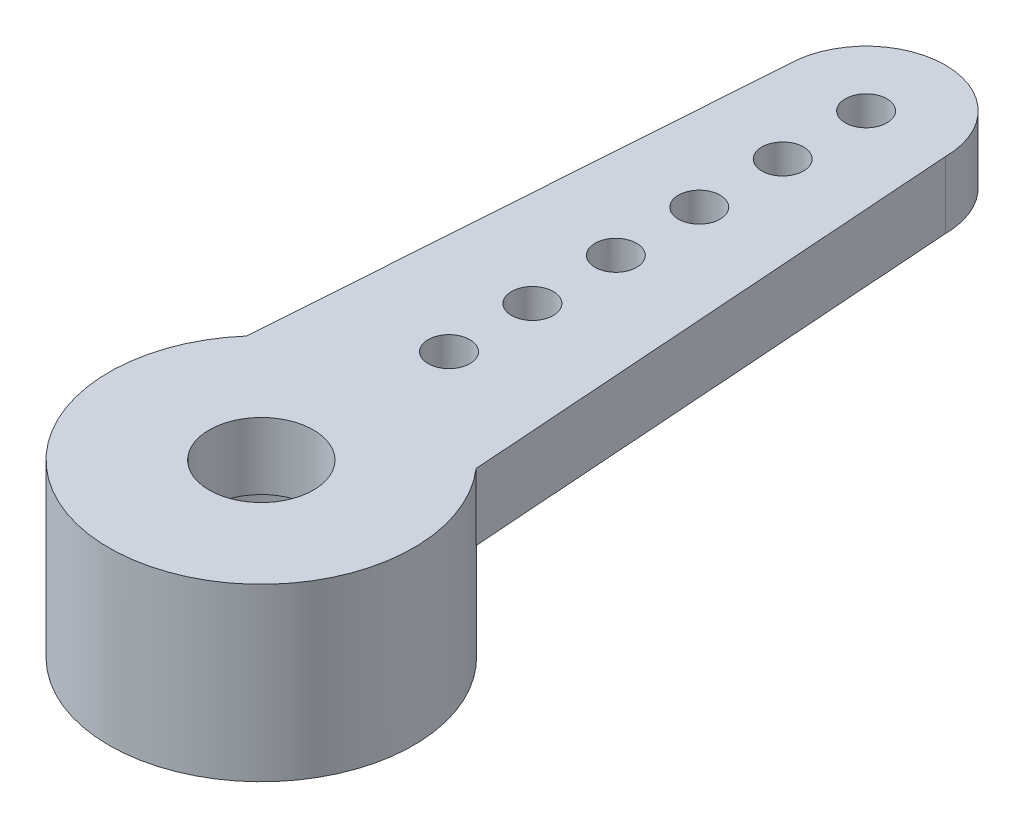
from build123d import *
from build123d.topology import SkipClean

# Parameters (mm, degrees)
SKETCH1_R           = 3.65
SKETCH1_R_2         = 2.5
BOSS_EXTRUDE1_DEPTH = 2.5
SKETCH2_R           = 1.25
BOSS_EXTRUDE2_DEPTH = 1.6
CUT_EXTRUDE1_REACH  = 19.294
SKETCH3_R           = 0.5


with BuildPart() as part:
    # Sketch1 → Boss-Extrude1 (new body)
    with BuildSketch(Plane(origin=(0, 0, 0), x_dir=(1, 0, 0), z_dir=(0, 1, 0))):
        Circle(SKETCH1_R)
        Circle(SKETCH1_R_2, mode=Mode.SUBTRACT)
    extrude(amount=BOSS_EXTRUDE1_DEPTH)

    # Sketch2 → Boss-Extrude2 (add)
    with SkipClean():  # the faces are left unmerged after this step: merging them gives an invalid solid
        with BuildSketch(Plane(origin=(0, 2.5, 0), x_dir=(1, 0, 0), z_dir=(0, 1, 0))):
            with BuildLine():
                Line((-2.75, 2.4), (-1.9, 14.5))
                ThreePointArc((-1.9, 14.5), (0, 16.4), (1.9, 14.5))
                Line((1.9, 14.5), (2.75, 2.4))
                ThreePointArc((2.75, 2.4), (0, -3.65), (-2.75, 2.4))
            make_face()
            Circle(SKETCH2_R, mode=Mode.SUBTRACT)
        extrude(amount=BOSS_EXTRUDE2_DEPTH)
    add(part.part.scale(1), mode=Mode.REPLACE)  # the faces are merged on a copy

    # Sketch3 → Cut-Extrude1 (cut, up to next)
    with BuildSketch(Plane(origin=(0, 4.1, 0), x_dir=(1, 0, 0), z_dir=(0, 1, 0)), mode=Mode.PRIVATE) as cut_extrude1_sk1:
        with Locations((0, 12.5)):
            Circle(SKETCH3_R)
    cut_extrude1_tool1 = extrude(cut_extrude1_sk1.sketch, amount=-CUT_EXTRUDE1_REACH, mode=Mode.PRIVATE) & part.part
    # Sketch3 → Cut-Extrude1 (cut, up to next)
    with BuildSketch(Plane(origin=(0, 4.1, 0), x_dir=(1, 0, 0), z_dir=(0, 1, 0)), mode=Mode.PRIVATE) as cut_extrude1_sk2:
        with Locations((0, 10.5)):
            Circle(SKETCH3_R)
    cut_extrude1_tool2 = extrude(cut_extrude1_sk2.sketch, amount=-CUT_EXTRUDE1_REACH, mode=Mode.PRIVATE) & part.part
    # Sketch3 → Cut-Extrude1 (cut, up to next)
    with BuildSketch(Plane(origin=(0, 4.1, 0), x_dir=(1, 0, 0), z_dir=(0, 1, 0)), mode=Mode.PRIVATE) as cut_extrude1_sk3:
        with Locations((0, 14.5)):
            Circle(SKETCH3_R)
    cut_extrude1_tool3 = extrude(cut_extrude1_sk3.sketch, amount=-CUT_EXTRUDE1_REACH, mode=Mode.PRIVATE) & part.part
    # Sketch3 → Cut-Extrude1 (cut, up to next)
    with BuildSketch(Plane(origin=(0, 4.1, 0), x_dir=(1, 0, 0), z_dir=(0, 1, 0)), mode=Mode.PRIVATE) as cut_extrude1_sk4:
        with Locations((0, 8.5)):
            Circle(SKETCH3_R)
    cut_extrude1_tool4 = extrude(cut_extrude1_sk4.sketch, amount=-CUT_EXTRUDE1_REACH, mode=Mode.PRIVATE) & part.part
    # Sketch3 → Cut-Extrude1 (cut, up to next)
    with BuildSketch(Plane(origin=(0, 4.1, 0), x_dir=(1, 0, 0), z_dir=(0, 1, 0)), mode=Mode.PRIVATE) as cut_extrude1_sk5:
        with Locations((0, 6.5)):
            Circle(SKETCH3_R)
    cut_extrude1_tool5 = extrude(cut_extrude1_sk5.sketch, amount=-CUT_EXTRUDE1_REACH, mode=Mode.PRIVATE) & part.part
    # Sketch3 → Cut-Extrude1 (cut, up to next)
    with BuildSketch(Plane(origin=(0, 4.1, 0), x_dir=(1, 0, 0), z_dir=(0, 1, 0)), mode=Mode.PRIVATE) as cut_extrude1_sk6:
        with Locations((0, 4.5)):
            Circle(SKETCH3_R)
    cut_extrude1_tool6 = extrude(cut_extrude1_sk6.sketch, amount=-CUT_EXTRUDE1_REACH, mode=Mode.PRIVATE) & part.part
    add(cut_extrude1_tool1.solids().sort_by_distance((0, 4.1, -12.5))[0], mode=Mode.SUBTRACT)
    add(cut_extrude1_tool2.solids().sort_by_distance((0, 4.1, -10.5))[0], mode=Mode.SUBTRACT)
    add(cut_extrude1_tool3.solids().sort_by_distance((0, 4.1, -14.5))[0], mode=Mode.SUBTRACT)
    add(cut_extrude1_tool4.solids().sort_by_distance((0, 4.1, -8.5))[0], mode=Mode.SUBTRACT)
    add(cut_extrude1_tool5.solids().sort_by_distance((0, 4.1, -6.5))[0], mode=Mode.SUBTRACT)
    add(cut_extrude1_tool6.solids().sort_by_distance((0, 4.1, -4.5))[0], mode=Mode.SUBTRACT)


solid = part.part
